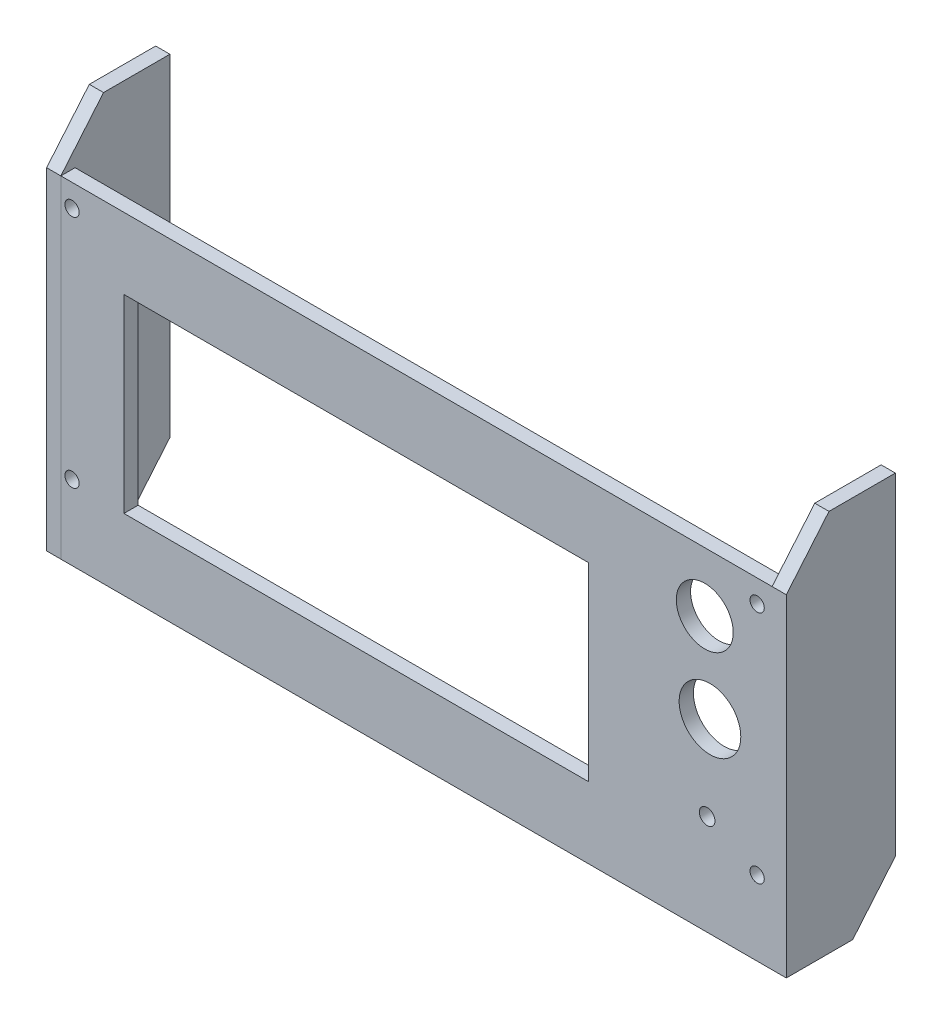
from build123d import *

# Parameters (mm, degrees)
CROQUIS1_W              = 150
CROQUIS1_H              = 70
CROQUIS1_R              = 6
SALIENTE_EXTRUIR1_DEPTH = 3
CROQUIS2_W              = 98
CROQUIS2_H              = 40
CORTAR_EXTRUIR1_DEPTH   = 3
CROQUIS3_R              = 6.5
CORTAR_EXTRUIR2_DEPTH   = 166.556636835
CROQUIS4_R              = 1.65
CORTAR_EXTRUIR3_DEPTH   = 3
CROQUIS5_R              = 1.5
CORTAR_EXTRUIR4_DEPTH   = 3
SALIENTE_EXTRUIR4_DEPTH = 3
SALIENTE_EXTRUIR5_DEPTH = 3


with BuildPart() as part:
    # Croquis1 → Saliente-Extruir1 (new body)
    with BuildSketch(Plane.XY):
        with Locations((75, 35)):
            Rectangle(CROQUIS1_W, CROQUIS1_H)
        with Locations((135.8, 57.5)):
            Circle(CROQUIS1_R, mode=Mode.SUBTRACT)
    extrude(amount=SALIENTE_EXTRUIR1_DEPTH)

    # Croquis2 → Cortar-Extruir1 (cut)
    with BuildSketch(Plane.XY.offset(3)):
        with Locations((62.3, 35)):
            Rectangle(CROQUIS2_W, CROQUIS2_H)
    extrude(amount=-CORTAR_EXTRUIR1_DEPTH, mode=Mode.SUBTRACT)

    # Croquis3 → Cortar-Extruir2 (cut, through all)
    with BuildSketch(Plane.XY.offset(3)):
        with Locations((136.9, 39.25)):
            Circle(CROQUIS3_R)
    extrude(amount=-CORTAR_EXTRUIR2_DEPTH, mode=Mode.SUBTRACT)

    # Croquis4 → Cortar-Extruir3 (cut)
    with BuildSketch(Plane.XY.offset(3)):
        with Locations((136.3, 21.15)):
            Circle(CROQUIS4_R)
    extrude(amount=-CORTAR_EXTRUIR3_DEPTH, mode=Mode.SUBTRACT)

    # Croquis5 → Cortar-Extruir4 (cut)
    with BuildSketch(Plane.XY.offset(3)):
        with Locations((146.85, 65.25)):
            Circle(CROQUIS5_R)
        with Locations((146.85, 15.75)):
            Circle(CROQUIS5_R)
        with Locations((2.35, 15.75)):
            Circle(CROQUIS5_R)
        with Locations((2.35, 65.25)):
            Circle(CROQUIS5_R)
    extrude(amount=-CORTAR_EXTRUIR4_DEPTH, mode=Mode.SUBTRACT)

    # Croquis7 → Saliente-Extruir4 (add)
    with BuildSketch(Plane(origin=(150, 0, 0), x_dir=(0, 0, -1), z_dir=(1, 0, 0))):
        Polygon((-3, 70), (6, 80.725782333), (20, 80.725782333), (20, 10.725782333), (11, 0), (-3, 0), align=None)
    extrude(amount=SALIENTE_EXTRUIR4_DEPTH)


with BuildPart() as body_2:
    # Croquis9 → Saliente-Extruir5 (new body)
    with BuildSketch(Plane.ZY):
        Polygon((-11, 0), (3, 0), (3, 70), (-6, 80.725782333), (-20, 80.725782333), (-20, 10.725782333), align=None)
    extrude(amount=SALIENTE_EXTRUIR5_DEPTH)


solid = Compound([part.part, body_2.part])
